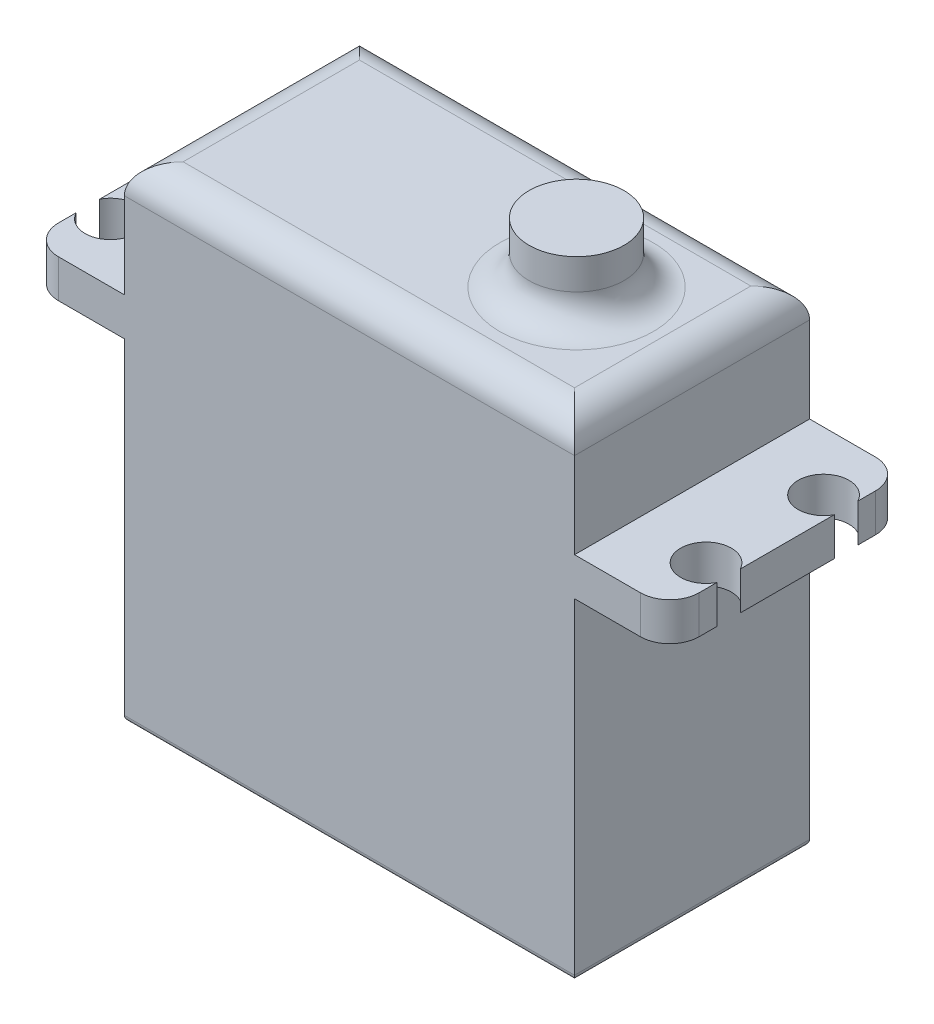
from build123d import *

# Parameters (mm, degrees)
BOSS_EXTRUDE2_DEPTH   = 3.24
BOSS_EXTRUDE2_2_DEPTH = 3.24
SKETCH1_9_W           = 38.3
SKETCH1_9_H           = 20
BOSS_EXTRUDE3_DEPTH   = 13.04
SKETCH2_R             = 4.04
BOSS_EXTRUDE4_DEPTH   = 5.1
SKETCH1_10_W          = 38.3
SKETCH1_10_H          = 20
BOSS_EXTRUDE7_DEPTH   = 16.74
SKETCH5_W             = 38.3
SKETCH5_H             = 20
BOSS_EXTRUDE8_DEPTH   = 11.5
FILLET1_R             = 2.5
FILLET2_R             = 0.5
CUT_EXTRUDE1_DEPTH    = 1.66


with BuildPart() as part:
    # Sketch1 → Boss-Extrude2 (new body)
    with BuildSketch(Plane(origin=(0, 0, 0), x_dir=(1, 0, 0), z_dir=(0, 1, 0))):
        with BuildLine():
            Line((-19.15, -10), (-19.15, 10))
            Line((-19.15, 10), (-24.75, 10))
            ThreePointArc((-24.75, 10), (-26.517766953, 9.267766953), (-27.25, 7.5))
            Line((-27.25, 7.5), (-27.25, 6))
            ThreePointArc((-27.25, 6), (-23.175424329, 5), (-27.25, 4))
            Line((-27.25, 4), (-27.25, -4))
            ThreePointArc((-27.25, -4), (-23.175424329, -5), (-27.25, -6))
            Line((-27.25, -6), (-27.25, -7.5))
            ThreePointArc((-27.25, -7.5), (-26.517766953, -9.267766953), (-24.75, -10))
            Line((-24.75, -10), (-19.15, -10))
        make_face()
    extrude(amount=BOSS_EXTRUDE2_DEPTH)



with BuildPart() as body_2:
    # Sketch1 → Boss-Extrude2 2 (new body)
    with BuildSketch(Plane(origin=(0, 0, 0), x_dir=(1, 0, 0), z_dir=(0, 1, 0))):
        with BuildLine():
            Line((24.75, 10), (19.15, 10))
            Line((19.15, 10), (19.15, -10))
            Line((19.15, -10), (24.75, -10))
            ThreePointArc((24.75, -10), (26.517766953, -9.267766953), (27.25, -7.5))
            Line((27.25, -7.5), (27.25, -6))
            ThreePointArc((27.25, -6), (23.175424329, -5), (27.25, -4))
            Line((27.25, -4), (27.25, 4))
            ThreePointArc((27.25, 4), (23.175424329, 5), (27.25, 6))
            Line((27.25, 6), (27.25, 7.5))
            ThreePointArc((27.25, 7.5), (26.517766953, 9.267766953), (24.75, 10))
        make_face()
    extrude(amount=BOSS_EXTRUDE2_2_DEPTH)


with BuildPart() as part_1:
    add(part.part)

    add(body_2.part)  # Boss-Extrude3 merges body 2
    # Sketch1<9> → Boss-Extrude3 (add)
    with BuildSketch(Plane(origin=(0, 0, 0), x_dir=(1, 0, 0), z_dir=(0, 1, 0))):
        Rectangle(SKETCH1_9_W, SKETCH1_9_H)
    extrude(amount=BOSS_EXTRUDE3_DEPTH)

    # Sketch2 → Boss-Extrude4 (add)
    with BuildSketch(Plane(origin=(0, 13.04, 0), x_dir=(1, 0, 0), z_dir=(0, 1, 0))):
        with Locations((9.32, 0)):
            Circle(SKETCH2_R)
    extrude(amount=BOSS_EXTRUDE4_DEPTH)

    # Sketch1<10> → Boss-Extrude7 (add)
    with BuildSketch(Plane(origin=(0, 0, 0), x_dir=(1, 0, 0), z_dir=(0, 1, 0))):
        Rectangle(SKETCH1_10_W, SKETCH1_10_H)
    extrude(amount=-BOSS_EXTRUDE7_DEPTH)

    # Sketch5 → Boss-Extrude8 (add)
    with BuildSketch(Plane.XZ.offset(16.74)):
        Rectangle(SKETCH5_W, SKETCH5_H)
    extrude(amount=BOSS_EXTRUDE8_DEPTH)

    # Fillet1
    fillet1_edges = [part_1.edges().sort_by_distance(p)[0] for p in [
        (0, 13.04, 10),
        (-19.15, 13.04, 0),
        (0, 13.04, -10),
        (19.15, 13.04, 0),
        (5.28, 13.04, 0),
    ]]
    fillet(fillet1_edges, radius=FILLET1_R)

    # Fillet2
    fillet2_edges = [part_1.edges().sort_by_distance(p)[0] for p in [
        (0, -28.24, 10),
        (19.15, -28.24, 0),
        (0, -28.24, -10),
        (-19.15, -28.24, 0),
    ]]
    fillet(fillet2_edges, radius=FILLET2_R)

    # Sketch6 → Cut-Extrude1 (cut)
    with BuildSketch(Plane.XZ.offset(28.24)):
        with BuildLine():
            Line((-18.65, 9.5), (-18.65, 5.04))
            Line((-18.65, 5.04), (-16.22, 5.04))
            ThreePointArc((-16.22, 5.04), (-14.784573234, 5.634573234), (-14.19, 7.07))
            Line((-14.19, 7.07), (-14.19, 9.5))
            Line((-14.19, 9.5), (-18.65, 9.5))
        make_face()
        with BuildLine():
            Line((-16.22, -5.04), (-18.65, -5.04))
            Line((-18.65, -5.04), (-18.65, -9.5))
            Line((-18.65, -9.5), (-14.19, -9.5))
            Line((-14.19, -9.5), (-14.19, -7.07))
            ThreePointArc((-14.19, -7.07), (-14.784573234, -5.634573234), (-16.22, -5.04))
        make_face()
        with BuildLine():
            Line((18.65, 9.5), (14.19, 9.5))
            Line((14.19, 9.5), (14.19, 6.97))
            ThreePointArc((14.19, 6.97), (14.784573234, 5.534573234), (16.22, 4.94))
            Line((16.22, 4.94), (18.65, 4.94))
            Line((18.65, 4.94), (18.65, 9.5))
        make_face()
        with BuildLine():
            Line((14.19, -7.07), (14.19, -9.5))
            Line((14.19, -9.5), (18.65, -9.5))
            Line((18.65, -9.5), (18.65, -5.04))
            Line((18.65, -5.04), (16.22, -5.04))
            ThreePointArc((16.22, -5.04), (14.784573234, -5.634573234), (14.19, -7.07))
        make_face()
    extrude(amount=-CUT_EXTRUDE1_DEPTH, mode=Mode.SUBTRACT)


solid = part_1.part
